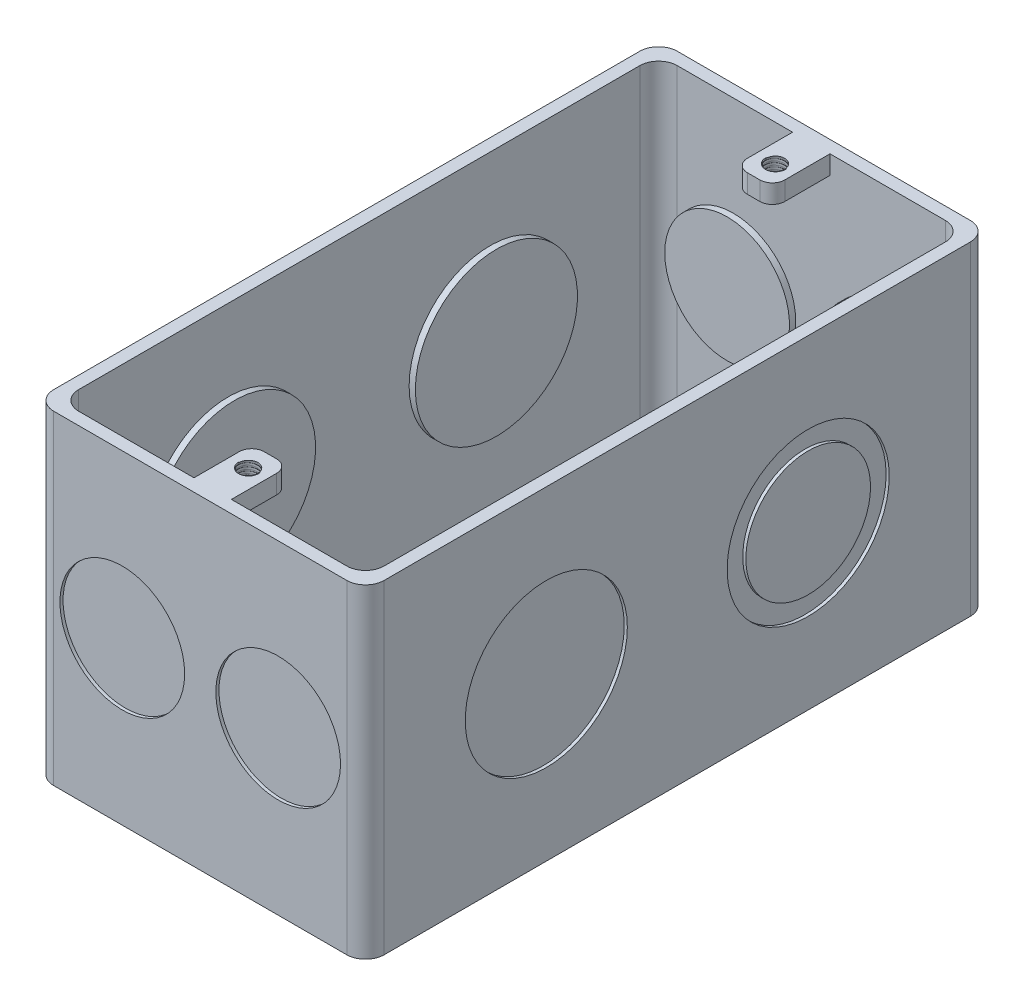
from build123d import *

# Parameters (mm, degrees)
CROQUIS1_W               = 53
CROQUIS1_H               = 100
SALIENTE_EXTRUIR5_DEPTH  = 52
CROQUIS6_W               = 49
CROQUIS6_H               = 96
CORTAR_EXTRUIR4_DEPTH    = 50
CROQUIS7_W               = 6
CROQUIS7_H               = 9.25
SALIENTE_EXTRUIR11_DEPTH = 3
CROQUIS8_R               = 2
CORTAR_EXTRUIR8_DEPTH    = 3
REDONDEO1_R              = 2
REDONDEO2_R              = 2
REDONDEO3_R              = 2
REDONDEO5_R              = 3
REDONDEO6_R              = 3
REDONDEO7_R              = 3
CROQUIS9_R               = 13
CORTAR_EXTRUIR9_DEPTH    = 0.5
CROQUIS10_R              = 13
SALIENTE_EXTRUIR12_DEPTH = 2.5
CROQUIS11_R              = 10
SALIENTE_EXTRUIR14_DEPTH = 0.5
CORTAR_EXTRUIR10_START   = -0.5
CROQUIS12_R              = 13
CORTAR_EXTRUIR10_DEPTH   = 0.5
SALIENTE_EXTRUIR15_START = -2.5
CROQUIS13_R              = 13
SALIENTE_EXTRUIR15_DEPTH = 2.5
CROQUIS14_R              = 10
SALIENTE_EXTRUIR16_DEPTH = 0.5
CROQUIS15_R              = 10
CORTAR_EXTRUIR12_DEPTH   = 0.5
CROQUIS16_R              = 10
SALIENTE_EXTRUIR18_DEPTH = 2.5
CORTAR_EXTRUIR13_START   = -0.5
CROQUIS17_R              = 10
CORTAR_EXTRUIR13_DEPTH   = 0.5
SALIENTE_EXTRUIR19_START = -2.5
CROQUIS18_R              = 10
SALIENTE_EXTRUIR19_DEPTH = 2.5
CORTAR_EXTRUIR14_DEPTH   = 0.5
CROQUIS20_R              = 14
SALIENTE_EXTRUIR20_DEPTH = 2.5
CROQUIS21_R              = 3
CORTAR_EXTRUIR15_DEPTH   = 25
CROQUIS22_R              = 1.5
CORTAR_EXTRUIR16_DEPTH   = 25
CORTAR_BARRER1_PITCH     = 0.5
CORTAR_BARRER2_PITCH     = 0.5
CROQUIS28_R              = 2.353766271
CROQUIS28_R_2            = 2.788045426
SALIENTE_EXTRUIR21_DEPTH = 3
CROQUIS29_R              = 1.5
CORTAR_EXTRUIR21_DEPTH   = 3
CORTAR_BARRER3_PITCH     = 0.583333333
CORTAR_BARRER4_PITCH     = 0.583333333


with BuildPart() as part:
    # Croquis1 → Saliente-Extruir5 (new body)
    with BuildSketch(Plane(origin=(0, 0, 0), x_dir=(1, 0, 0), z_dir=(0, 1, 0))):
        Rectangle(CROQUIS1_W, CROQUIS1_H)
    extrude(amount=SALIENTE_EXTRUIR5_DEPTH)

    # Croquis6 → Cortar-Extruir4 (cut)
    with BuildSketch(Plane(origin=(0, 52, 0), x_dir=(1, 0, 0), z_dir=(0, 1, 0))):
        Rectangle(CROQUIS6_W, CROQUIS6_H)
    extrude(amount=-CORTAR_EXTRUIR4_DEPTH, mode=Mode.SUBTRACT)

    # Croquis7 → Saliente-Extruir11 (add)
    with BuildSketch(Plane(origin=(0, 52, 0), x_dir=(1, 0, 0), z_dir=(0, 1, 0))):
        with Locations((0, 43.375)):
            Rectangle(CROQUIS7_W, CROQUIS7_H)
        Polygon((0, -48), (3, -48), (3, -38.75), (-3, -38.75), (-3, -48), align=None)
    extrude(amount=-SALIENTE_EXTRUIR11_DEPTH)

    # Croquis8 → Cortar-Extruir8 (cut)
    with BuildSketch(Plane(origin=(0, 52, 0), x_dir=(1, 0, 0), z_dir=(0, 1, 0))):
        with Locations(Location((0, 42.25, 0), (0, 0, 270))):
            Circle(CROQUIS8_R)
        with Locations(Location((0, -42.25, 0), (0, 0, 270))):
            Circle(CROQUIS8_R)
    extrude(amount=-CORTAR_EXTRUIR8_DEPTH, mode=Mode.SUBTRACT)

    # Redondeo1
    redondeo1_edges = [part.edges().sort_by_distance(p)[0] for p in [
        (-3, 50.5, 38.75),
    ]]
    fillet(redondeo1_edges, radius=REDONDEO1_R)

    # Redondeo2
    redondeo2_edges = [part.edges().sort_by_distance(p)[0] for p in [
        (3, 50.5, 38.75),
    ]]
    fillet(redondeo2_edges, radius=REDONDEO2_R)

    # Redondeo3
    redondeo3_edges = [part.edges().sort_by_distance(p)[0] for p in [
        (3, 50.5, -38.75),
        (-3, 50.5, -38.75),
    ]]
    fillet(redondeo3_edges, radius=REDONDEO3_R)

    # Redondeo5
    redondeo5_edges = [part.edges().sort_by_distance(p)[0] for p in [
        (-26.5, 26, -50),
    ]]
    fillet(redondeo5_edges, radius=REDONDEO5_R)

    # Redondeo6
    redondeo6_edges = [part.edges().sort_by_distance(p)[0] for p in [
        (-24.5, 27, -48),
    ]]
    fillet(redondeo6_edges, radius=REDONDEO6_R)

    # Redondeo7
    redondeo7_edges = [part.edges().sort_by_distance(p)[0] for p in [
        (24.5, 27, -48),
        (24.5, 27, 48),
        (-24.5, 27, 48),
        (26.5, 26, 50),
        (-26.5, 26, 50),
        (26.5, 26, -50),
    ]]
    fillet(redondeo7_edges, radius=REDONDEO7_R)

    # Croquis9 → Cortar-Extruir9 (cut)
    with BuildSketch(Plane.ZY.offset(26.5)):
        with Locations((21, 26)):
            Circle(CROQUIS9_R)
        with Locations((-21, 26)):
            Circle(CROQUIS9_R)
    extrude(amount=-CORTAR_EXTRUIR9_DEPTH, mode=Mode.SUBTRACT)

    # Croquis10 → Saliente-Extruir12 (add)
    with BuildSketch(Plane.ZY.offset(26)):
        with Locations((21, 26)):
            Circle(CROQUIS10_R)
        with Locations((-21, 26)):
            Circle(CROQUIS10_R)
    extrude(amount=-SALIENTE_EXTRUIR12_DEPTH)

    # Croquis11 → Saliente-Extruir14 (add)
    with BuildSketch(Plane.ZY.offset(26.5)):
        with Locations((21, 26)):
            Circle(CROQUIS11_R)
    extrude(amount=-SALIENTE_EXTRUIR14_DEPTH)

    # Croquis12 → Cortar-Extruir10 (cut)
    with BuildSketch(Plane(origin=(26.5, 0, 0), x_dir=(0, 0, -1), z_dir=(1, 0, 0)).offset(CORTAR_EXTRUIR10_START)):
        with Locations(Location((21, 26, 0), (0, 0, 180))):
            Circle(CROQUIS12_R)
        with Locations(Location((-21, 26, 0), (0, 0, 180))):
            Circle(CROQUIS12_R)
    extrude(amount=CORTAR_EXTRUIR10_DEPTH, mode=Mode.SUBTRACT)

    # Croquis13 → Saliente-Extruir15 (add)
    with BuildSketch(Plane(origin=(26, 0, 0), x_dir=(0, 0, -1), z_dir=(1, 0, 0)).offset(SALIENTE_EXTRUIR15_START)):
        with Locations(Location((21, 26, 0), (0, 0, 180))):
            Circle(CROQUIS13_R)
        with Locations(Location((-21, 26, 0), (0, 0, 180))):
            Circle(CROQUIS13_R)
    extrude(amount=SALIENTE_EXTRUIR15_DEPTH)

    # Croquis14 → Saliente-Extruir16 (add)
    with BuildSketch(Plane(origin=(26, 0, 0), x_dir=(0, 0, -1), z_dir=(1, 0, 0))):
        with Locations((21, 26)):
            Circle(CROQUIS14_R)
    extrude(amount=SALIENTE_EXTRUIR16_DEPTH)

    # Croquis15 → Cortar-Extruir12 (cut)
    with BuildSketch(Plane.XY.offset(50)):
        with Locations((-12.5, 26)):
            Circle(CROQUIS15_R)
        with Locations((12.5, 26)):
            Circle(CROQUIS15_R)
    extrude(amount=-CORTAR_EXTRUIR12_DEPTH, mode=Mode.SUBTRACT)

    # Croquis16 → Saliente-Extruir18 (add)
    with BuildSketch(Plane.XY.offset(49.5)):
        with Locations((-12.5, 26)):
            Circle(CROQUIS16_R)
        with Locations((12.5, 26)):
            Circle(CROQUIS16_R)
    extrude(amount=-SALIENTE_EXTRUIR18_DEPTH)

    # Croquis17 → Cortar-Extruir13 (cut)
    with BuildSketch(Plane(origin=(0, 0, -50), x_dir=(-1, 0, 0), z_dir=(0, 0, -1)).offset(CORTAR_EXTRUIR13_START)):
        with Locations(Location((-12.5, 26, 0), (0, 0, 180))):
            Circle(CROQUIS17_R)
        with Locations(Location((12.5, 26, 0), (0, 0, 180))):
            Circle(CROQUIS17_R)
    extrude(amount=CORTAR_EXTRUIR13_DEPTH, mode=Mode.SUBTRACT)

    # Croquis18 → Saliente-Extruir19 (add)
    with BuildSketch(Plane(origin=(0, 0, -49.5), x_dir=(-1, 0, 0), z_dir=(0, 0, -1)).offset(SALIENTE_EXTRUIR19_START)):
        with Locations(Location((-12.5, 26, 0), (0, 0, 180))):
            Circle(CROQUIS18_R)
        with Locations(Location((12.5, 26, 0), (0, 0, 180))):
            Circle(CROQUIS18_R)
    extrude(amount=SALIENTE_EXTRUIR19_DEPTH)

    # Croquis19 → Cortar-Extruir14 (cut)
    with BuildSketch(Plane.XZ):
        with BuildLine():
            ThreePointArc((14, 19), (9.899494937, 28.899494937), (0, 33))
            Line((0, 33), (0, 5))
            ThreePointArc((0, 5), (9.899494937, 9.100505063), (14, 19))
        make_face()
        with BuildLine():
            Line((0, 5), (0, 33))
            ThreePointArc((0, 33), (-14, 19), (0, 5))
        make_face()
        with BuildLine():
            ThreePointArc((14, -19), (9.899494937, -9.100505063), (0, -5))
            Line((0, -5), (0, -33))
            ThreePointArc((0, -33), (9.899494937, -28.899494937), (14, -19))
        make_face()
        with BuildLine():
            Line((0, -33), (0, -5))
            ThreePointArc((0, -5), (-14, -19), (0, -33))
        make_face()
    extrude(amount=-CORTAR_EXTRUIR14_DEPTH, mode=Mode.SUBTRACT)

    # Croquis20 → Saliente-Extruir20 (add)
    with BuildSketch(Plane.XZ.offset(-0.5)):
        with Locations(Location((0, 19, 0), (0, 0, 270))):
            Circle(CROQUIS20_R)
        with Locations(Location((0, -19, 0), (0, 0, 270))):
            Circle(CROQUIS20_R)
    extrude(amount=-SALIENTE_EXTRUIR20_DEPTH)

    # Croquis21 → Cortar-Extruir15 (cut)
    with BuildSketch(Plane.XZ):
        with Locations(Location((-13.5, -37, 0), (0, 0, 270))):
            Circle(CROQUIS21_R)
        with Locations(Location((13.5, 37, 0), (0, 0, 270))):
            Circle(CROQUIS21_R)
    extrude(amount=-CORTAR_EXTRUIR15_DEPTH, mode=Mode.SUBTRACT)

    # Croquis22 → Cortar-Extruir16 (cut)
    with BuildSketch(Plane.XZ):
        with Locations(Location((13.5, -37, 0), (0, 0, 270))):
            Circle(CROQUIS22_R)
    extrude(amount=-CORTAR_EXTRUIR16_DEPTH, mode=Mode.SUBTRACT)

    # Cortar-Barrer1: arcs per turn and ends read off the stored shape
    # Cortar-Barrer1: the profile of Croquis25 screwed along a right-hand helix through 7.666667 turns, 6 arcs to a turn; built about Z, then put on its axis
    cortar_barrer1_z = Axis((0, 0, 0), (0, 0, 1))
    cortar_barrer1_corners = [(1.8, 0, -0.5), (2.1, 0, -0.673205081), (2.1, 0, -0.326794919)]
    with BuildLine(mode=Mode.PRIVATE) as cortar_barrer1_profile:
        Line(cortar_barrer1_corners[0], cortar_barrer1_corners[1])
        Line(cortar_barrer1_corners[1], cortar_barrer1_corners[2])
        Line(cortar_barrer1_corners[2], cortar_barrer1_corners[0])
    cortar_barrer1_cap = Face(cortar_barrer1_profile.wire())
    cortar_barrer1_turn_angles = [0, 30, 60, 90, 120, 150, 180, 210, 240, 270, 300, 330, 360]
    cortar_barrer1_turn_weights = [1, 0.8660254037844387, 1, 0.8660254037844387, 1, 0.8660254037844387, 1, 0.8660254037844387, 1, 0.8660254037844387, 1, 0.8660254037844387, 1]
    cortar_barrer1_turn_rails = [Edge.make_bspline([Vector(p[0], p[1], 0).rotate(cortar_barrer1_z, cortar_barrer1_turn_angles[k]) / cortar_barrer1_turn_weights[k] + Vector(0, 0, p[2] + CORTAR_BARRER1_PITCH * cortar_barrer1_turn_angles[k] / 360) for k in range(13)], [0, 0, 0, 1, 1, 2, 2, 3, 3, 4, 4, 5, 5, 6, 6, 6], 2, cortar_barrer1_turn_weights) for p in cortar_barrer1_corners]
    cortar_barrer1_turn_sides = [Face.make_surface_from_curves(cortar_barrer1_turn_rails[p[0]], cortar_barrer1_turn_rails[p[1]]) for p in [(0, 1), (1, 2), (2, 0)]]
    cortar_barrer1_last_angles = [2520, 2550, 2580, 2610, 2640, 2670, 2700, 2730, 2760]
    cortar_barrer1_last_weights = [1, 0.8660254037844387, 1, 0.8660254037844387, 1, 0.8660254037844387, 1, 0.8660254037844387, 1]
    cortar_barrer1_last_rails = [Edge.make_bspline([Vector(p[0], p[1], 0).rotate(cortar_barrer1_z, cortar_barrer1_last_angles[k]) / cortar_barrer1_last_weights[k] + Vector(0, 0, p[2] + CORTAR_BARRER1_PITCH * cortar_barrer1_last_angles[k] / 360) for k in range(9)], [0, 0, 0, 1, 1, 2, 2, 3, 3, 4, 4, 4], 2, cortar_barrer1_last_weights) for p in cortar_barrer1_corners]
    cortar_barrer1_last_sides = [Face.make_surface_from_curves(cortar_barrer1_last_rails[p[0]], cortar_barrer1_last_rails[p[1]]) for p in [(0, 1), (1, 2), (2, 0)]]
    cortar_barrer1 = Plane(origin=(0, 52, -42.25), x_dir=(0, 0, 1), z_dir=(0, -1, 0)) * Solid(Shell([*[p.moved(Location((0, 0, CORTAR_BARRER1_PITCH * i))) for i in range(7) for p in cortar_barrer1_turn_sides], *cortar_barrer1_last_sides, cortar_barrer1_cap, cortar_barrer1_cap.rotate(cortar_barrer1_z, 2760).moved(Location((0, 0, CORTAR_BARRER1_PITCH * 2760 / 360)))]))
    add(cortar_barrer1, mode=Mode.SUBTRACT)

    # Cortar-Barrer2: arcs per turn and ends read off the stored shape
    # Cortar-Barrer2: the profile of Croquis27 screwed along a right-hand helix through 7.666667 turns, 6 arcs to a turn; built about Z, then put on its axis
    cortar_barrer2_z = Axis((0, 0, 0), (0, 0, 1))
    cortar_barrer2_corners = [(1.8, 0, -0.5), (2.1, 0, -0.673205081), (2.1, 0, -0.326794919)]
    with BuildLine(mode=Mode.PRIVATE) as cortar_barrer2_profile:
        Line(cortar_barrer2_corners[0], cortar_barrer2_corners[1])
        Line(cortar_barrer2_corners[1], cortar_barrer2_corners[2])
        Line(cortar_barrer2_corners[2], cortar_barrer2_corners[0])
    cortar_barrer2_cap = Face(cortar_barrer2_profile.wire())
    cortar_barrer2_turn_angles = [0, 30, 60, 90, 120, 150, 180, 210, 240, 270, 300, 330, 360]
    cortar_barrer2_turn_weights = [1, 0.8660254037844387, 1, 0.8660254037844387, 1, 0.8660254037844387, 1, 0.8660254037844387, 1, 0.8660254037844387, 1, 0.8660254037844387, 1]
    cortar_barrer2_turn_rails = [Edge.make_bspline([Vector(p[0], p[1], 0).rotate(cortar_barrer2_z, cortar_barrer2_turn_angles[k]) / cortar_barrer2_turn_weights[k] + Vector(0, 0, p[2] + CORTAR_BARRER2_PITCH * cortar_barrer2_turn_angles[k] / 360) for k in range(13)], [0, 0, 0, 1, 1, 2, 2, 3, 3, 4, 4, 5, 5, 6, 6, 6], 2, cortar_barrer2_turn_weights) for p in cortar_barrer2_corners]
    cortar_barrer2_turn_sides = [Face.make_surface_from_curves(cortar_barrer2_turn_rails[p[0]], cortar_barrer2_turn_rails[p[1]]) for p in [(0, 1), (1, 2), (2, 0)]]
    cortar_barrer2_last_angles = [2520, 2550, 2580, 2610, 2640, 2670, 2700, 2730, 2760]
    cortar_barrer2_last_weights = [1, 0.8660254037844387, 1, 0.8660254037844387, 1, 0.8660254037844387, 1, 0.8660254037844387, 1]
    cortar_barrer2_last_rails = [Edge.make_bspline([Vector(p[0], p[1], 0).rotate(cortar_barrer2_z, cortar_barrer2_last_angles[k]) / cortar_barrer2_last_weights[k] + Vector(0, 0, p[2] + CORTAR_BARRER2_PITCH * cortar_barrer2_last_angles[k] / 360) for k in range(9)], [0, 0, 0, 1, 1, 2, 2, 3, 3, 4, 4, 4], 2, cortar_barrer2_last_weights) for p in cortar_barrer2_corners]
    cortar_barrer2_last_sides = [Face.make_surface_from_curves(cortar_barrer2_last_rails[p[0]], cortar_barrer2_last_rails[p[1]]) for p in [(0, 1), (1, 2), (2, 0)]]
    cortar_barrer2 = Plane(origin=(0, 52, 42.25), x_dir=(0, 0, 1), z_dir=(0, -1, 0)) * Solid(Shell([*[p.moved(Location((0, 0, CORTAR_BARRER2_PITCH * i))) for i in range(7) for p in cortar_barrer2_turn_sides], *cortar_barrer2_last_sides, cortar_barrer2_cap, cortar_barrer2_cap.rotate(cortar_barrer2_z, 2760).moved(Location((0, 0, CORTAR_BARRER2_PITCH * 2760 / 360)))]))
    add(cortar_barrer2, mode=Mode.SUBTRACT)

    # Croquis28 → Saliente-Extruir21 (add)
    with BuildSketch(Plane(origin=(0, 52, 0), x_dir=(1, 0, 0), z_dir=(0, 1, 0))):
        with Locations((0, 42.25)):
            Circle(CROQUIS28_R)
        with Locations((0, -42.25)):
            Circle(CROQUIS28_R_2)
    extrude(amount=-SALIENTE_EXTRUIR21_DEPTH)

    # Croquis29 → Cortar-Extruir21 (cut)
    with BuildSketch(Plane(origin=(0, 52, 0), x_dir=(1, 0, 0), z_dir=(0, 1, 0))):
        with Locations(Location((0, 42.25, 0), (0, 0, 270))):
            Circle(CROQUIS29_R)
        with Locations(Location((0, -42.25, 0), (0, 0, 270))):
            Circle(CROQUIS29_R)
    extrude(amount=-CORTAR_EXTRUIR21_DEPTH, mode=Mode.SUBTRACT)

    # Cortar-Barrer3: arcs per turn and ends read off the stored shape
    # Cortar-Barrer3: the profile of Croquis32 screwed along a right-hand helix through 7 turns, 6 arcs to a turn; built about Z, then put on its axis
    cortar_barrer3_z = Axis((0, 0, 0), (0, 0, 1))
    cortar_barrer3_corners = [(1.3, 0, -0.583333333), (1.6, 0, -0.756538414), (1.6, 0, -0.410128253)]
    with BuildLine(mode=Mode.PRIVATE) as cortar_barrer3_profile:
        Line(cortar_barrer3_corners[0], cortar_barrer3_corners[1])
        Line(cortar_barrer3_corners[1], cortar_barrer3_corners[2])
        Line(cortar_barrer3_corners[2], cortar_barrer3_corners[0])
    cortar_barrer3_cap = Face(cortar_barrer3_profile.wire())
    cortar_barrer3_turn_angles = [0, 30, 60, 90, 120, 150, 180, 210, 240, 270, 300, 330, 360]
    cortar_barrer3_turn_weights = [1, 0.8660254037844387, 1, 0.8660254037844387, 1, 0.8660254037844387, 1, 0.8660254037844387, 1, 0.8660254037844387, 1, 0.8660254037844387, 1]
    cortar_barrer3_turn_rails = [Edge.make_bspline([Vector(p[0], p[1], 0).rotate(cortar_barrer3_z, cortar_barrer3_turn_angles[k]) / cortar_barrer3_turn_weights[k] + Vector(0, 0, p[2] + CORTAR_BARRER3_PITCH * cortar_barrer3_turn_angles[k] / 360) for k in range(13)], [0, 0, 0, 1, 1, 2, 2, 3, 3, 4, 4, 5, 5, 6, 6, 6], 2, cortar_barrer3_turn_weights) for p in cortar_barrer3_corners]
    cortar_barrer3_turn_sides = [Face.make_surface_from_curves(cortar_barrer3_turn_rails[p[0]], cortar_barrer3_turn_rails[p[1]]) for p in [(0, 1), (1, 2), (2, 0)]]
    cortar_barrer3 = Plane(origin=(0, 52, -42.25), x_dir=(0, 0, 1), z_dir=(0, -1, 0)) * Solid(Shell([*[p.moved(Location((0, 0, CORTAR_BARRER3_PITCH * i))) for i in range(7) for p in cortar_barrer3_turn_sides], cortar_barrer3_cap, cortar_barrer3_cap.rotate(cortar_barrer3_z, 2520).moved(Location((0, 0, CORTAR_BARRER3_PITCH * 2520 / 360)))]))
    add(cortar_barrer3, mode=Mode.SUBTRACT)

    # Cortar-Barrer4: arcs per turn and ends read off the stored shape
    # Cortar-Barrer4: the profile of Croquis34 screwed along a right-hand helix through 7 turns, 6 arcs to a turn; built about Z, then put on its axis
    cortar_barrer4_z = Axis((0, 0, 0), (0, 0, 1))
    cortar_barrer4_corners = [(1.3, 0, -0.583333333), (1.6, 0, -0.756538414), (1.6, 0, -0.410128253)]
    with BuildLine(mode=Mode.PRIVATE) as cortar_barrer4_profile:
        Line(cortar_barrer4_corners[0], cortar_barrer4_corners[1])
        Line(cortar_barrer4_corners[1], cortar_barrer4_corners[2])
        Line(cortar_barrer4_corners[2], cortar_barrer4_corners[0])
    cortar_barrer4_cap = Face(cortar_barrer4_profile.wire())
    cortar_barrer4_turn_angles = [0, 30, 60, 90, 120, 150, 180, 210, 240, 270, 300, 330, 360]
    cortar_barrer4_turn_weights = [1, 0.8660254037844387, 1, 0.8660254037844387, 1, 0.8660254037844387, 1, 0.8660254037844387, 1, 0.8660254037844387, 1, 0.8660254037844387, 1]
    cortar_barrer4_turn_rails = [Edge.make_bspline([Vector(p[0], p[1], 0).rotate(cortar_barrer4_z, cortar_barrer4_turn_angles[k]) / cortar_barrer4_turn_weights[k] + Vector(0, 0, p[2] + CORTAR_BARRER4_PITCH * cortar_barrer4_turn_angles[k] / 360) for k in range(13)], [0, 0, 0, 1, 1, 2, 2, 3, 3, 4, 4, 5, 5, 6, 6, 6], 2, cortar_barrer4_turn_weights) for p in cortar_barrer4_corners]
    cortar_barrer4_turn_sides = [Face.make_surface_from_curves(cortar_barrer4_turn_rails[p[0]], cortar_barrer4_turn_rails[p[1]]) for p in [(0, 1), (1, 2), (2, 0)]]
    cortar_barrer4 = Plane(origin=(0, 52, 42.25), x_dir=(0, 0, 1), z_dir=(0, -1, 0)) * Solid(Shell([*[p.moved(Location((0, 0, CORTAR_BARRER4_PITCH * i))) for i in range(7) for p in cortar_barrer4_turn_sides], cortar_barrer4_cap, cortar_barrer4_cap.rotate(cortar_barrer4_z, 2520).moved(Location((0, 0, CORTAR_BARRER4_PITCH * 2520 / 360)))]))
    add(cortar_barrer4, mode=Mode.SUBTRACT)


solid = part.part
